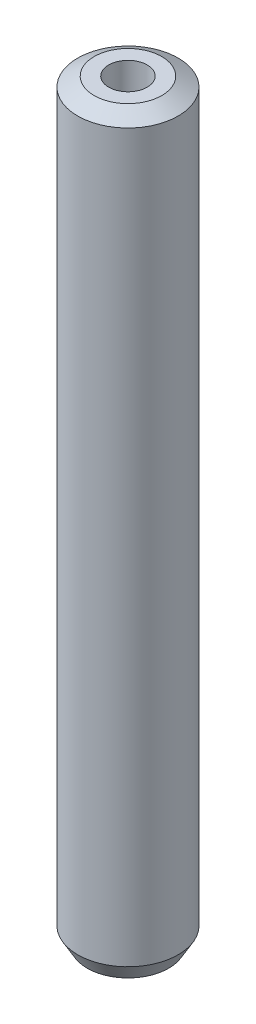
from build123d import *
from OCP.BRepFilletAPI import BRepFilletAPI_MakeChamfer

# Parameters (mm, degrees)
SKETCH1_R           = 5
BOSS_EXTRUDE1_DEPTH = 74.863959419
SKETCH2_R           = 1.918672231
CUT_EXTRUDE1_DEPTH  = 76.197156993
CHAMFER1_SIZE       = 0.944668841
CHAMFER1_SIZE2      = 1.636214429


with BuildPart() as part:
    # Sketch1 → Boss-Extrude1 (new body)
    with BuildSketch(Plane(origin=(0, 0, 0), x_dir=(1, 0, 0), z_dir=(0, 1, 0))):
        Circle(SKETCH1_R)
    extrude(amount=BOSS_EXTRUDE1_DEPTH)

    # Sketch2 → Cut-Extrude1 (cut, through all)
    with BuildSketch(Plane(origin=(0, 0, 0), x_dir=(1, 0, 0), z_dir=(0, 1, 0))):
        Circle(SKETCH2_R)
    extrude(amount=CUT_EXTRUDE1_DEPTH, mode=Mode.SUBTRACT)

    # Chamfer1: one chamfer whose edges measure the first distance from different faces: ONE call of the kernel's chamfer builder (chamfer() names one face for all edges)
    chamfer1_edges_1 = [part.edges().sort_by_distance(p)[0] for p in [
        (-5, 74.863959419, 0),
    ]]
    chamfer1_side_1 = [part.faces().sort_by_distance(p)[0] for p in [
        (-5, 37.431979709, 0),
    ]]
    chamfer1_edges_2 = [part.edges().sort_by_distance(p)[0] for p in [
        (-5, 0, 0),
    ]]
    chamfer1_side_2 = [part.faces().sort_by_distance(p)[0] for p in [
        (-4.858578644, 0, 0),
    ]]
    chamfer1 = BRepFilletAPI_MakeChamfer(part.part.solid().wrapped)
    for e in chamfer1_edges_1:
        chamfer1.Add(CHAMFER1_SIZE, CHAMFER1_SIZE2, e.wrapped, chamfer1_side_1[0].wrapped)  # the first distance lies on this face
    for e in chamfer1_edges_2:
        chamfer1.Add(CHAMFER1_SIZE, CHAMFER1_SIZE2, e.wrapped, chamfer1_side_2[0].wrapped)  # the first distance lies on this face
    add(Compound.cast(chamfer1.Shape()), mode=Mode.REPLACE)


solid = part.part
